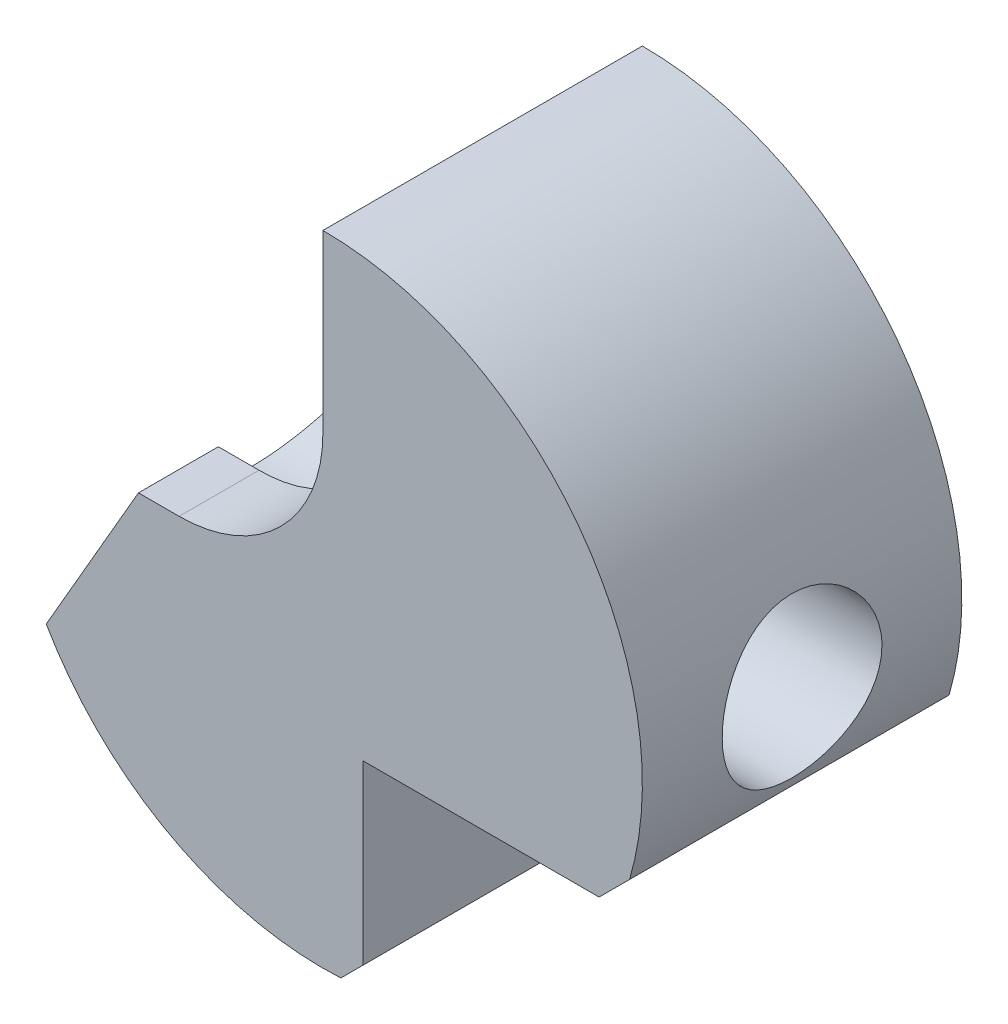
from build123d import *

# Parameters (mm, degrees)
SKETCH1_R           = 20
BOSS_EXTRUDE1_DEPTH = 10
CUT_EXTRUDE1_DEPTH  = 33
SKETCH5_W           = 27.400462
SKETCH5_H           = 25.39372
CUT_EXTRUDE3_DEPTH  = 66
FILLET1_R           = 9
SKETCH6_W           = 26.303109
SKETCH6_H           = 19.36506
CUT_EXTRUDE4_DEPTH  = 33
CHAMFER1_SIZE       = 1.25
CHAMFER2_SIZE       = 1.25
SKETCH7_R           = 5
CUT_EXTRUDE5_DEPTH  = 33


with BuildPart() as part:
    # Sketch1 → Boss-Extrude1 (new, symmetric)
    with BuildSketch(Plane.XY):
        Circle(SKETCH1_R)
    extrude(amount=BOSS_EXTRUDE1_DEPTH, both=True)

    # Sketch2 → Cut-Extrude1 (cut, symmetric)
    with BuildSketch(Plane.XY.offset(10)):
        Polygon((0, 20), (0, 24.336587), (-29.859429, 24.336587), (-29.859429, -31.718049), align=None)
    extrude(amount=CUT_EXTRUDE1_DEPTH, both=True, mode=Mode.SUBTRACT)

    # Sketch5 → Cut-Extrude3 (cut)
    with BuildSketch(Plane.XY):
        with Locations((-13.700231, 12.69686)):
            Rectangle(SKETCH5_W, SKETCH5_H)
    extrude(amount=CUT_EXTRUDE3_DEPTH, mode=Mode.SUBTRACT)

    # Fillet1
    fillet1_edges = [part.edges().sort_by_distance(p)[0] for p in [
        (0, 0, 5),
    ]]
    fillet(fillet1_edges, radius=FILLET1_R)

    # Sketch6 → Cut-Extrude4 (cut, symmetric)
    with BuildSketch(Plane.XY):
        with Locations((15.651554, -17.18253)):
            Rectangle(SKETCH6_W, SKETCH6_H)
    extrude(amount=CUT_EXTRUDE4_DEPTH, both=True, mode=Mode.SUBTRACT)

    # Chamfer1
    # the kernel refuses this chamfer: 1.441493, 1.25 mm, written as the material it takes off along each edge
    with BuildSketch(Plane(origin=(2.5, -19.843135, -13.564195), x_dir=(0, 1, 0), z_dir=(0, 0, 1))) as chamfer1_piece_1:
        with BuildLine():
            Line((CHAMFER1_SIZE, 0), (-0.125211, 1.375211))
            ThreePointArc((-0.125211, 1.375211), (-0.076474, 0.708578), (0, 0))
            Line((0, 0), (CHAMFER1_SIZE, 0))
        make_face()
    extrude(amount=27.128391, mode=Mode.SUBTRACT)

    # Chamfer2
    # the kernel refuses this chamfer: 2.264391, 1.25 mm, written as the material it takes off along each edge
    with BuildSketch(Plane(origin=(18.540496, -7.5, -15.267547), x_dir=(0.32758486719281943, 0.944821758209591, 0), z_dir=(0, 0, 1))) as chamfer2_piece_1:
        with BuildLine():
            Line((2.025154, 0), (-CHAMFER2_SIZE * 0.327584867193, CHAMFER2_SIZE * 0.94482175821))
            Line((-CHAMFER2_SIZE * 0.327584867193, CHAMFER2_SIZE * 0.94482175821), (0, 0))
            ThreePointArc((0, 0), (1.053336, -0.025608), (2.025154, 0))
        make_face()
    extrude(amount=30.535093, mode=Mode.SUBTRACT)

    # Sketch7 → Cut-Extrude5 (cut, symmetric)
    with BuildSketch(Plane(origin=(0, 0, 0), x_dir=(0, 0, -1), z_dir=(1, 0, 0))):
        Circle(SKETCH7_R)
    extrude(amount=CUT_EXTRUDE5_DEPTH, both=True, mode=Mode.SUBTRACT)


solid = part.part
